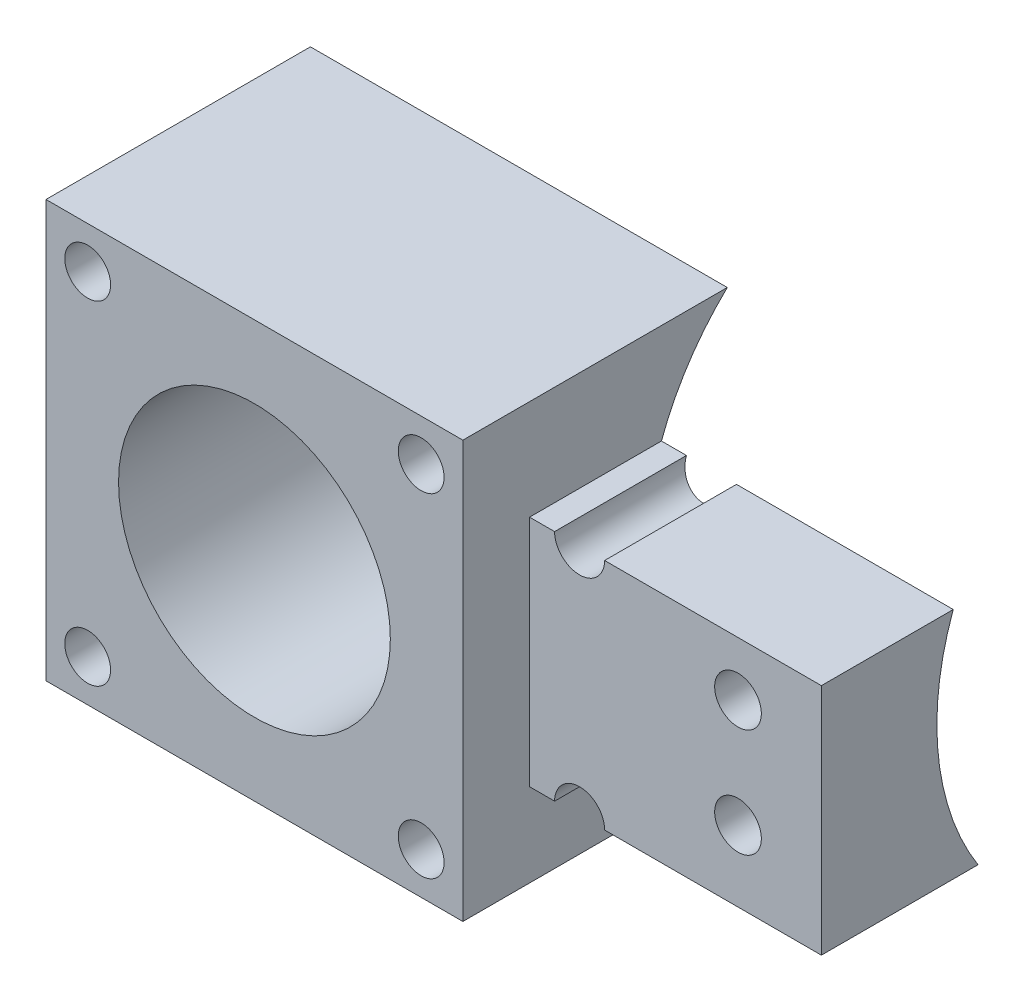
from build123d import *
from build123d.topology import SkipClean

# Parameters (mm, degrees)
SKETCH1_W               = 50
SKETCH1_H               = 50
SKETCH1_R               = 16.3
SKETCH1_R_2             = 2.75
BOSS_EXTRUDE1_DEPTH     = 53.6
CUT_EXTRUDE1_DEPTH      = 66.015075175
CUT_EXTRUDE1_DEPTH_BACK = 66.015075175
SKETCH2_R               = 31.75
BOSS_EXTRUDE3_START     = 35
BOSS_EXTRUDE3_DEPTH     = 35
SKETCH12_W              = 35
SKETCH12_H              = 28
CUT_EXTRUDE7_DEPTH      = 8
CUT_EXTRUDE5_DEPTH      = 85.864362462
CUT_EXTRUDE5_DEPTH_BACK = 85.864362462
SKETCH9_R               = 3
CUT_EXTRUDE6_DEPTH      = 72.860361661
CUT_EXTRUDE6_DEPTH_BACK = 10
SKETCH10_R              = 2.8


with BuildPart() as part:
    # Sketch1 → Boss-Extrude1 (new body)
    with BuildSketch(Plane.XY):
        with Locations((0, -2)):
            Rectangle(SKETCH1_W, SKETCH1_H)
        with Locations((0, -2)):
            Circle(SKETCH1_R, mode=Mode.SUBTRACT)
        with Locations((-20, 18)):
            Circle(SKETCH1_R_2, mode=Mode.SUBTRACT)
        with Locations((20, 18)):
            Circle(SKETCH1_R_2, mode=Mode.SUBTRACT)
        with Locations((20, -22)):
            Circle(SKETCH1_R_2, mode=Mode.SUBTRACT)
        with Locations((-20, -22)):
            Circle(SKETCH1_R_2, mode=Mode.SUBTRACT)
    extrude(amount=BOSS_EXTRUDE1_DEPTH)

    # Sketch2 → Cut-Extrude1 (cut, two sides: drawn at the far end of the back side and taken through both)
    with BuildSketch(Plane(origin=(0, 0, 0), x_dir=(0, 0, -1), z_dir=(1, 0, 0)).offset(-CUT_EXTRUDE1_DEPTH_BACK)):
        Circle(SKETCH2_R)
    extrude(amount=CUT_EXTRUDE1_DEPTH + CUT_EXTRUDE1_DEPTH_BACK, mode=Mode.SUBTRACT)

    # Sketch4 → Boss-Extrude3 (add)
    with SkipClean():  # the faces are left unmerged after this step: merging them gives an invalid solid
        with BuildSketch(Plane(origin=(25, 0, 0), x_dir=(0, 0, -1), z_dir=(1, 0, 0)).offset(BOSS_EXTRUDE3_START)):
            with BuildLine():
                Line((-53.6, 11), (-53.6, -17))
                Line((-53.6, -17), (-26.815340759, -17))
                ThreePointArc((-26.815340759, -17), (-31.573087709, -3.347033393), (-29.783594477, 11))
                Line((-29.783594477, 11), (-53.6, 11))
            make_face()
        extrude(amount=-BOSS_EXTRUDE3_DEPTH)

    # Sketch12 → Cut-Extrude7 (cut)
    with SkipClean():  # the faces are left unmerged after this step: merging them gives an invalid solid
        with BuildSketch(Plane.XY.offset(53.6)):
            with Locations((42.5, -3)):
                Rectangle(SKETCH12_W, SKETCH12_H)
        extrude(amount=-CUT_EXTRUDE7_DEPTH, mode=Mode.SUBTRACT)

    # Sketch9 → Cut-Extrude5 (cut, two sides: drawn at the far end of the back side and taken through both)
    with SkipClean():  # the faces are left unmerged after this step: merging them gives an invalid solid
        with BuildSketch(Plane.XY.offset(-CUT_EXTRUDE5_DEPTH_BACK)):
            with Locations((31, 11)):
                Circle(SKETCH9_R)
            with Locations((31, -17)):
                Circle(SKETCH9_R)
        extrude(amount=CUT_EXTRUDE5_DEPTH + CUT_EXTRUDE5_DEPTH_BACK, mode=Mode.SUBTRACT)

    # Sketch10 → Cut-Extrude6 (cut, two sides: drawn at the far end of the back side and taken through both)
    with SkipClean():  # the faces are left unmerged after this step: merging them gives an invalid solid
        with BuildSketch(Plane.XY.offset(45.6).offset(-CUT_EXTRUDE6_DEPTH_BACK)):
            with Locations((50, 4.5)):
                Circle(SKETCH10_R)
            with Locations((50, -8.5)):
                Circle(SKETCH10_R)
        extrude(amount=CUT_EXTRUDE6_DEPTH + CUT_EXTRUDE6_DEPTH_BACK, mode=Mode.SUBTRACT)


solid = part.part
